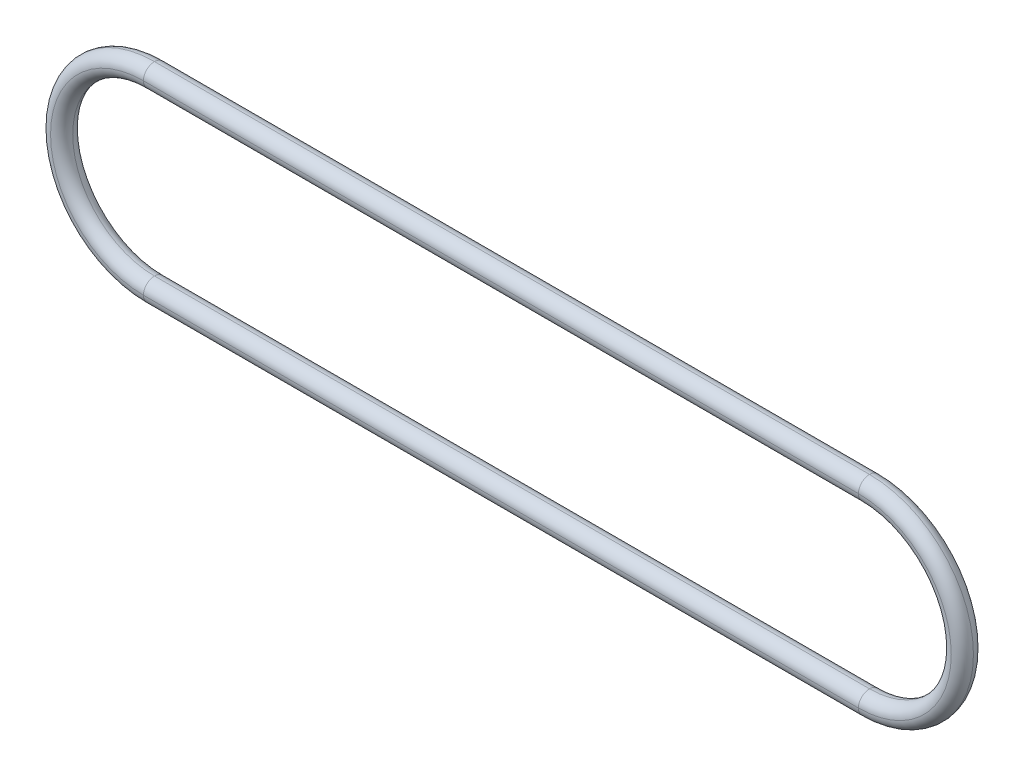
from build123d import *

# Parameters (mm, degrees)
BOSS_EXTRU_1_DEPTH = 4
CONG_1_R           = 2


with BuildPart() as part:
    # Esquisse1 → Boss.-Extru.1 (new body)
    with BuildSketch(Plane.XY):
        with BuildLine():
            Line((0, 18.75), (129, 18.75))
            ThreePointArc((129, 18.75), (147.75, 0), (129, -18.75))
            Line((129, -18.75), (0, -18.75))
            ThreePointArc((0, -18.75), (-18.75, 0), (0, 18.75))
        make_face()
        with BuildLine():
            Line((0, 14.75), (129, 14.75))
            ThreePointArc((129, 14.75), (143.75, 0), (129, -14.75))
            Line((129, -14.75), (0, -14.75))
            ThreePointArc((0, -14.75), (-14.75, 0), (0, 14.75))
        make_face(mode=Mode.SUBTRACT)
    extrude(amount=BOSS_EXTRU_1_DEPTH)

    # Congé1
    cong_1_edges = [part.edges().sort_by_distance(p)[0] for p in [
        (143.75, 0, 0),
        (64.5, -14.75, 0),
        (-14.75, 0, 0),
        (147.75, 0, 0),
        (64.5, -18.75, 0),
        (-18.75, 0, 0),
        (143.75, 0, 4),
        (64.5, -14.75, 4),
        (-14.75, 0, 4),
        (147.75, 0, 4),
        (64.5, -18.75, 4),
        (-18.75, 0, 4),
        (64.5, 14.75, 0),
        (64.5, 18.75, 0),
        (64.5, 14.75, 4),
        (64.5, 18.75, 4),
    ]]
    fillet(cong_1_edges, radius=CONG_1_R - 0.0001)  # a hair under: the kernel refuses the full size


solid = part.part
